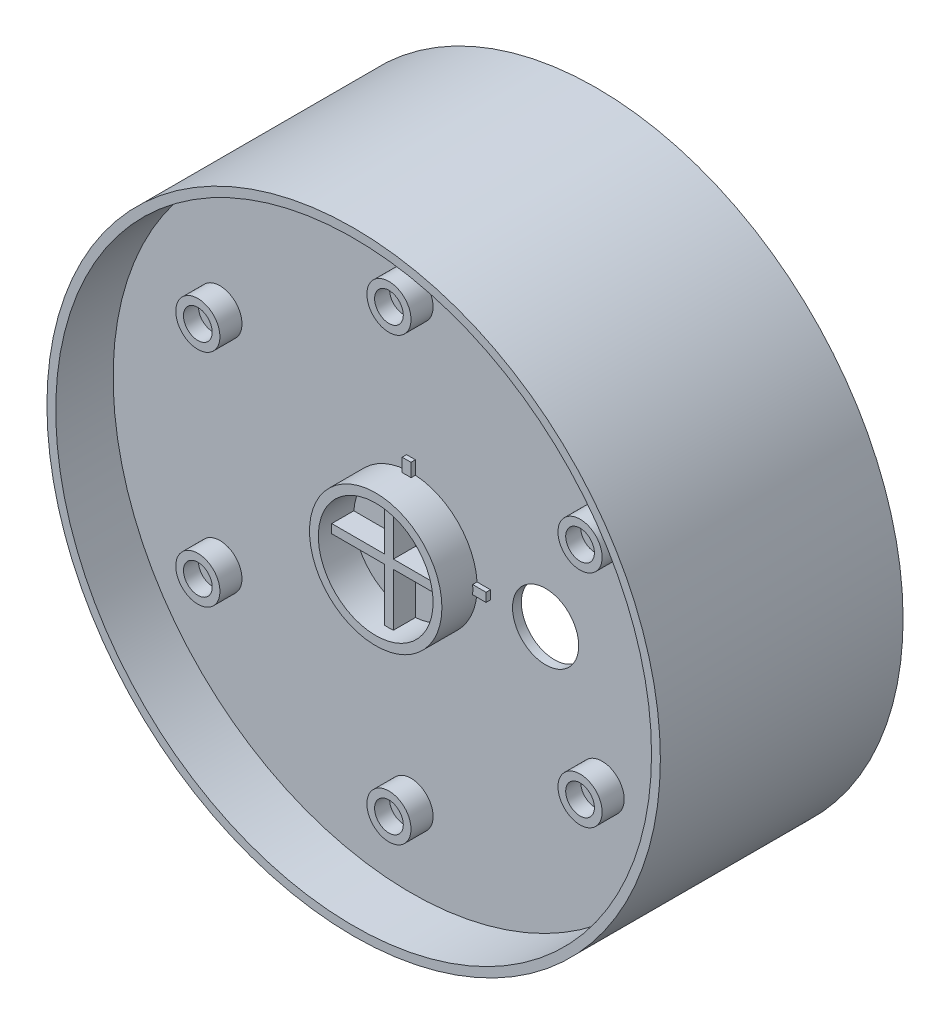
from build123d import *

# Parameters (mm, degrees)
SKETCH_1_W                  = 69.5
SKETCH_1_H                  = 55
HOLE_WIZARD_1_D             = 135
HOLE_WIZARD_1_DEPTH         = 13
SKETCH_4_R                  = 15
EXTRUDE_1_DEPTH             = 8
HOLE_WIZARD_M22_1_D         = 26
HOLE_WIZARD_M22_1_DEPTH     = 8
EXTRUDE_2_DEPTH             = 5
CUT_EXTRUDE_START           = -5
CUT_EXTRUDE_1_DEPTH         = 5
CUT_EXTRUDE_2_DEPTH         = 5
CUT_EXTRUDE_3_DEPTH         = 5
HOLE_WIZARD_2_D             = 135
HOLE_WIZARD_2_DEPTH         = 40
THICKEN_START               = -4.2
THICKEN_1_OUTLINE_W         = 3
THICKEN_1_OUTLINE_H         = 6
THICKEN_1_DEPTH             = 8.4
SKETCH_13_W                 = 5
SKETCH_13_H                 = 5
SKETCH_14_W                 = 5
SKETCH_14_H                 = 5
SKETCH_15_W                 = 5
SKETCH_15_H                 = 5
SKETCH_16_W                 = 5
SKETCH_16_H                 = 5
SKETCH_17_W                 = 5
SKETCH_17_H                 = 5
SKETCH_18_W                 = 5
SKETCH_18_H                 = 5
SKETCH_19_W                 = 2.5
SKETCH_19_H                 = 37
SKETCH_20_W                 = 2.5
SKETCH_20_H                 = 37
SKETCH_21_W                 = 2.5
SKETCH_21_H                 = 37
SKETCH_22_W                 = 2.5
SKETCH_22_H                 = 37
HOLE_WIZARD_6_5_6_5_1_D     = 6.5
HOLE_WIZARD_6_5_6_5_1_DEPTH = 3.4
HOLE_WIZARD_15_0_15_1_D     = 15
HOLE_WIZARD_15_0_15_1_DEPTH = 15
HOLE_WIZARD_6_0_6_1_D       = 6
HOLE_WIZARD_6_0_6_1_DEPTH   = 29.048717705
RIB_START                   = -1
RIB_1_OUTLINE_W             = 1
RIB_1_OUTLINE_H             = 4
RIB_1_DEPTH                 = 2
RIB_2_OUTLINE_W             = 4
RIB_2_OUTLINE_H             = 1
RIB_2_DEPTH                 = 2
RIB_3_OUTLINE_W             = 4
RIB_3_OUTLINE_H             = 1
RIB_3_DEPTH                 = 2
RIB_4_OUTLINE_W             = 4
RIB_4_OUTLINE_H             = 1
RIB_4_DEPTH                 = 2


# Read off the part's stored shape, not the designer's step: 切除-加厚1, 筋1, 筋2, 筋3, 筋4
with BuildPart() as part:
    # 草图1 → 旋转1 (revolve)
    with BuildSketch(Plane.XZ, mode=Mode.PRIVATE) as revolve_1_sk:
        with Locations((34.75, 27.5)):
            Rectangle(SKETCH_1_W, SKETCH_1_H)
    revolve(revolve_1_sk.sketch.rotate(Axis((0, 0, 55), (0, 0, -1)), 180), axis=Axis((0, 0, 55), (0, 0, -1)))

    # 孔1
    with Locations(Plane.XY.offset(55)):
        with Locations((0, 0)):
            Hole(HOLE_WIZARD_1_D / 2, depth=HOLE_WIZARD_1_DEPTH)

    # 草图4 → 凸台-拉伸1 (add)
    with BuildSketch(Plane.XY.offset(42)):
        with Locations(Location((0, 0, 0), (0, 0, 180))):
            Circle(SKETCH_4_R)
    extrude(amount=EXTRUDE_1_DEPTH)

    # M22 间隙孔1
    with Locations(Plane.XY.offset(50)):
        with Locations((0, 0)):
            Hole(HOLE_WIZARD_M22_1_D / 2, depth=HOLE_WIZARD_M22_1_DEPTH)

    # 草图7 → 凸台-拉伸2 (add)
    with BuildSketch(Plane.XY.offset(42)):
        with BuildLine():
            Line((12.961481397, -1), (1, -1))
            Line((1, -1), (1, -12.961481397))
            ThreePointArc((1, -12.961481397), (-9.192388155, 9.192388155), (12.961481397, -1))
        make_face()
    extrude(amount=EXTRUDE_2_DEPTH)

    # 草图8 → 切除-拉伸1 (cut)
    with BuildSketch(Plane.XY.offset(47).offset(CUT_EXTRUDE_START)):
        with BuildLine():
            Line((-1, -12.961481397), (-1, -1))
            Line((-1, -1), (-12.961481397, -1))
            ThreePointArc((-12.961481397, -1), (-9.192388155, -9.192388155), (-1, -12.961481397))
        make_face()
    extrude(amount=CUT_EXTRUDE_1_DEPTH, mode=Mode.SUBTRACT)

    # 草图9 → 切除-拉伸2 (cut)
    with BuildSketch(Plane.XY.offset(47).offset(CUT_EXTRUDE_START)):
        with BuildLine():
            Line((-12.961481397, 1), (-1, 1))
            Line((-1, 1), (-1, 12.961481397))
            ThreePointArc((-1, 12.961481397), (-9.192388155, 9.192388155), (-12.961481397, 1))
        make_face()
    extrude(amount=CUT_EXTRUDE_2_DEPTH, mode=Mode.SUBTRACT)

    # 草图10 → 切除-拉伸3 (cut)
    with BuildSketch(Plane.XY.offset(47).offset(CUT_EXTRUDE_START)):
        with BuildLine():
            Line((1, 12.961481397), (1, 1))
            Line((1, 1), (12.961481397, 1))
            ThreePointArc((12.961481397, 1), (9.192388155, 9.192388155), (1, 12.961481397))
        make_face()
    extrude(amount=CUT_EXTRUDE_3_DEPTH, mode=Mode.SUBTRACT)

    # 孔2
    with Locations(Plane(origin=(0, 0, 0), x_dir=(-1, 0, 0), z_dir=(0, 0, -1))):
        with Locations((0, 0)):
            Hole(HOLE_WIZARD_2_D / 2, depth=HOLE_WIZARD_2_DEPTH)

    # 切除-加厚1 outline → 切除-加厚1 (cut)
    with BuildSketch(Plane(origin=(0, 0, 0), x_dir=(0.5591929034707426, 0.8290375725550445, 0), z_dir=(0.8290375725550445, -0.5591929034707428, 0)).offset(THICKEN_START)):
        with Locations((-68.5, 3)):
            Rectangle(THICKEN_1_OUTLINE_W, THICKEN_1_OUTLINE_H)
    extrude(amount=THICKEN_1_DEPTH, mode=Mode.SUBTRACT)

    # 草图13 → 旋转2 (revolve)
    with BuildSketch(Plane.XZ.offset(25), mode=Mode.PRIVATE) as revolve_2_sk:
        with Locations((45.801270189, 44.5)):
            Rectangle(SKETCH_13_W, SKETCH_13_H)
    revolve(revolve_2_sk.sketch.rotate(Axis((43.301270189, -25, 47), (0, 0, -1)), 180), axis=Axis((43.301270189, -25, 47), (0, 0, -1)))

    # 草图14 → 旋转3 (revolve)
    with BuildSketch(Plane.XZ.offset(-25), mode=Mode.PRIVATE) as revolve_3_sk:
        with Locations((45.801270189, 44.5)):
            Rectangle(SKETCH_14_W, SKETCH_14_H)
    revolve(revolve_3_sk.sketch.rotate(Axis((43.301270189, 25, 47), (0, 0, -1)), 180), axis=Axis((43.301270189, 25, 47), (0, 0, -1)))

    # 草图15 → 旋转4 (revolve)
    with BuildSketch(Plane.XZ.offset(-50), mode=Mode.PRIVATE) as revolve_4_sk:
        with Locations((2.5, 44.5)):
            Rectangle(SKETCH_15_W, SKETCH_15_H)
    revolve(revolve_4_sk.sketch.rotate(Axis((0, 50, 47), (0, 0, -1)), 180), axis=Axis((0, 50, 47), (0, 0, -1)))

    # 草图16 → 旋转5 (revolve)
    with BuildSketch(Plane.XZ.offset(-25), mode=Mode.PRIVATE) as revolve_5_sk:
        with Locations((-40.801270189, 44.5)):
            Rectangle(SKETCH_16_W, SKETCH_16_H)
    revolve(revolve_5_sk.sketch.rotate(Axis((-43.301270189, 25, 47), (0, 0, -1)), 180), axis=Axis((-43.301270189, 25, 47), (0, 0, -1)))

    # 草图17 → 旋转6 (revolve)
    with BuildSketch(Plane.XZ.offset(25), mode=Mode.PRIVATE) as revolve_6_sk:
        with Locations((-40.801270189, 44.5)):
            Rectangle(SKETCH_17_W, SKETCH_17_H)
    revolve(revolve_6_sk.sketch.rotate(Axis((-43.301270189, -25, 47), (0, 0, -1)), 180), axis=Axis((-43.301270189, -25, 47), (0, 0, -1)))

    # 草图18 → 旋转7 (revolve)
    with BuildSketch(Plane.XZ.offset(50), mode=Mode.PRIVATE) as revolve_7_sk:
        with Locations((2.5, 44.5)):
            Rectangle(SKETCH_18_W, SKETCH_18_H)
    revolve(revolve_7_sk.sketch.rotate(Axis((0, -50, 47), (0, 0, -1)), 180), axis=Axis((0, -50, 47), (0, 0, -1)))

    # 草图19 → 旋转8 (revolve)
    with BuildSketch(Plane(origin=(0, -11.468398436, 0), x_dir=(1, 0, 0), z_dir=(0, 1, 0))):
        with Locations((-57.749795231, -21.5)):
            Rectangle(SKETCH_19_W, SKETCH_19_H)
    revolve(axis=Axis((-58.999795231, -11.468398436, 3), (0, 0, 1)))

    # 草图20 → 旋转9 (revolve)
    with BuildSketch(Plane(origin=(0, -58.999795231, 0), x_dir=(1, 0, 0), z_dir=(0, 1, 0))):
        with Locations((12.718398436, -21.5)):
            Rectangle(SKETCH_20_W, SKETCH_20_H)
    revolve(axis=Axis((11.468398436, -58.999795231, 3), (0, 0, 1)))

    # 草图21 → 旋转10 (revolve)
    with BuildSketch(Plane(origin=(0, 58.999795231, 0), x_dir=(1, 0, 0), z_dir=(0, 1, 0))):
        with Locations((-10.218398436, -21.5)):
            Rectangle(SKETCH_21_W, SKETCH_21_H)
    revolve(axis=Axis((-11.468398436, 58.999795231, 3), (0, 0, 1)))

    # 草图22 → 旋转11 (revolve)
    with BuildSketch(Plane(origin=(0, 11.468398436, 0), x_dir=(1, 0, 0), z_dir=(0, 1, 0))):
        with Locations((60.249795231, -21.5)):
            Rectangle(SKETCH_22_W, SKETCH_22_H)
    revolve(axis=Axis((58.999795231, 11.468398436, 3), (0, 0, 1)))

    # Ø6.5 (6.5) 直径孔1
    with Locations(Plane.XY.offset(47)):
        with Locations((0, -50), (-43.301270189, -25), (-43.301270189, 25), (0, 50), (43.301270189, 25), (43.301270189, -25)):
            Hole(HOLE_WIZARD_6_5_6_5_1_D / 2, depth=HOLE_WIZARD_6_5_6_5_1_DEPTH)

    # Ø15.0 (15) 直径孔1
    with Locations(Plane(origin=(0, 0, 40), x_dir=(-1, 0, 0), z_dir=(0, 0, -1))):
        with Locations((-30.5, 0)):
            Hole(HOLE_WIZARD_15_0_15_1_D / 2, depth=HOLE_WIZARD_15_0_15_1_DEPTH)

    # Ø6.0 (6) 直径孔1
    with Locations(Plane(origin=(-37.70822303, -55.904739656, 0), x_dir=(0.8290375725550408, -0.5591929034707481, 0), z_dir=(0.5591929034707481, 0.8290375725550408, 0))):
        with Locations((0, -6)):
            Hole(HOLE_WIZARD_6_0_6_1_D / 2, depth=HOLE_WIZARD_6_0_6_1_DEPTH)

    # 筋1 outline → 筋1 (add)
    with BuildSketch(Plane(origin=(0, 0, 0), x_dir=(0, 0, -1), z_dir=(1, 0, 0)).offset(RIB_START)):
        with Locations((-42.5, -16)):
            Rectangle(RIB_1_OUTLINE_W, RIB_1_OUTLINE_H)
    extrude(amount=RIB_1_DEPTH)

    # 筋2 outline → 筋2 (add)
    with BuildSketch(Plane(origin=(0, 0, 0), x_dir=(0, -1, 0), z_dir=(-1, 0, 0)).offset(RIB_START)):
        with Locations((-16, 42.5)):
            Rectangle(RIB_2_OUTLINE_W, RIB_2_OUTLINE_H)
    extrude(amount=RIB_2_DEPTH)

    # 筋3 outline → 筋3 (add)
    with BuildSketch(Plane(origin=(0, 0, 0), x_dir=(1, 0, 0), z_dir=(0, 1, 0)).offset(RIB_START)):
        with Locations((16, -42.5)):
            Rectangle(RIB_3_OUTLINE_W, RIB_3_OUTLINE_H)
    extrude(amount=RIB_3_DEPTH)

    # 筋4 outline → 筋4 (add)
    with BuildSketch(Plane(origin=(0, 0, 0), x_dir=(1, 0, 0), z_dir=(0, 1, 0)).offset(RIB_START)):
        with Locations((-16, -42.5)):
            Rectangle(RIB_4_OUTLINE_W, RIB_4_OUTLINE_H)
    extrude(amount=RIB_4_DEPTH)


solid = part.part
